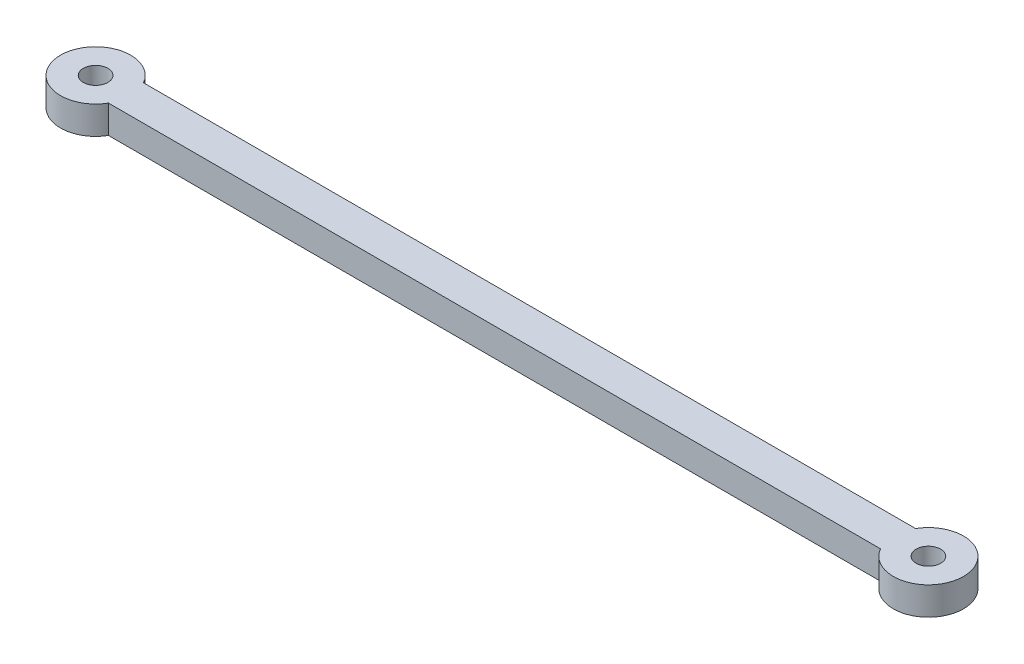
from build123d import *

# Parameters (mm, degrees)
BOSS_EXTRUDE1_DEPTH = 4
SKETCH2_R           = 1.75
CUT_EXTRUDE1_DEPTH  = 65.64801035


with BuildPart() as part:
    # Sketch1 → Boss-Extrude1 (new body)
    with BuildSketch(Plane(origin=(0, 0, 0), x_dir=(1, 0, 0), z_dir=(0, 1, 0))):
        with BuildLine():
            Line((-55, 2.5), (55, 2.5))
            ThreePointArc((55, 2.5), (64.330127019, 0), (55, -2.5))
            Line((55, -2.5), (-55, -2.5))
            ThreePointArc((-55, -2.5), (-64.330127019, 0), (-55, 2.5))
        make_face()
    extrude(amount=BOSS_EXTRUDE1_DEPTH)

    # Sketch2 → Cut-Extrude1 (cut, through all)
    with BuildSketch(Plane(origin=(0, 4, 0), x_dir=(1, 0, 0), z_dir=(0, 1, 0))):
        with Locations((-59.330127019, 0)):
            Circle(SKETCH2_R)
        with Locations((59.330127019, 0)):
            Circle(SKETCH2_R)
    extrude(amount=-CUT_EXTRUDE1_DEPTH, mode=Mode.SUBTRACT)


solid = part.part
